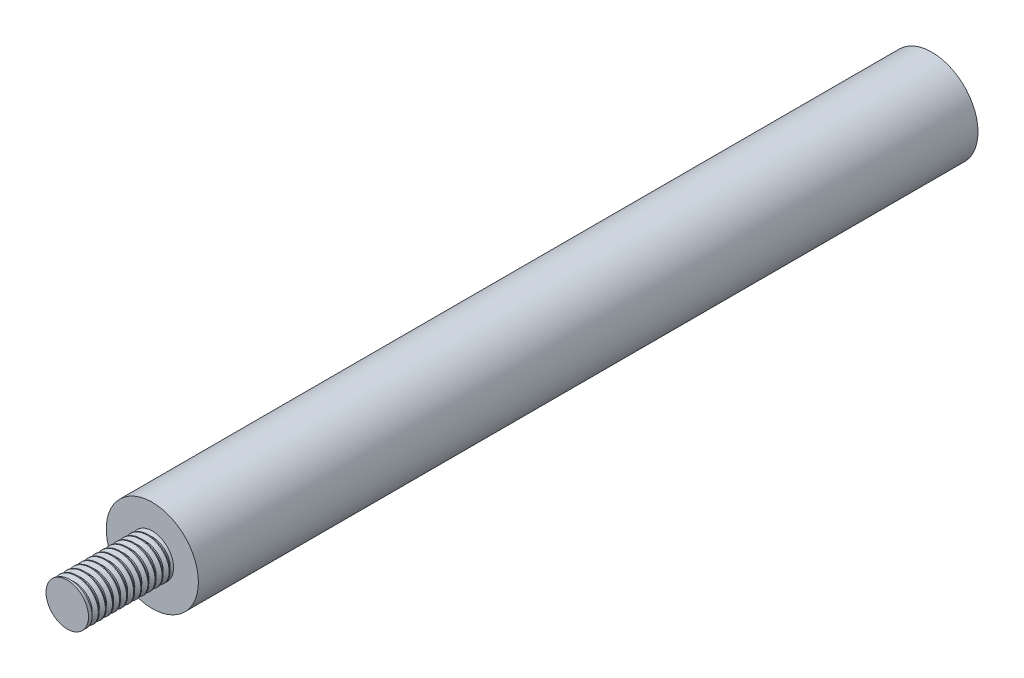
from build123d import *

# Parameters (mm, degrees)
SKETCH1_R           = 3
BOSS_EXTRUDE1_DEPTH = 122
SKETCH1_3_R         = 6.5
SKETCH1_3_R_2       = 3
BOSS_EXTRUDE2_DEPTH = 110
THREAD1_PITCH       = 1
SKETCH4_R           = 3
CUT_EXTRUDE1_DEPTH  = 10


with BuildPart() as part:
    # Sketch1 → Boss-Extrude1 (new body)
    with BuildSketch(Plane.XY):
        with Locations(Location((0, 0, 0), (0, 0, 180))):
            Circle(SKETCH1_R)
    extrude(amount=BOSS_EXTRUDE1_DEPTH)

    # Sketch1<3> → Boss-Extrude2 (add)
    with BuildSketch(Plane.XY):
        Circle(SKETCH1_3_R)
        with Locations(Location((0, 0, 0), (0, 0, 180))):
            Circle(SKETCH1_3_R_2, mode=Mode.SUBTRACT)
    extrude(amount=BOSS_EXTRUDE2_DEPTH)

    # Thread1: the profile of Thread Profile1 profile screwed along a right-hand helix of 12 turns, 8 arcs to a turn; built about Z, then put on its axis
    thread1_z = Axis((0, 0, 0), (0, 0, 1))
    thread1_corners = [(3.0003, 0, -0.000173205), (3.0003, 0, 0.875173202), (2.458734125, 0, 0.562499999), (2.458734125, 0, 0.312499999)]
    with BuildLine(mode=Mode.PRIVATE) as thread1_profile:
        Line(thread1_corners[0], thread1_corners[1])
        Line(thread1_corners[1], thread1_corners[2])
        Line(thread1_corners[2], thread1_corners[3])
        Line(thread1_corners[3], thread1_corners[0])
    thread1_cap = Face(thread1_profile.wire())
    thread1_turn_angles = [0, 22.5, 45, 67.5, 90, 112.5, 135, 157.5, 180, 202.5, 225, 247.5, 270, 292.5, 315, 337.5, 360]
    thread1_turn_weights = [1, 0.9238795325112867, 1, 0.9238795325112867, 1, 0.9238795325112867, 1, 0.9238795325112867, 1, 0.9238795325112867, 1, 0.9238795325112867, 1, 0.9238795325112867, 1, 0.9238795325112867, 1]
    thread1_turn_rails = [Edge.make_bspline([Vector(p[0], p[1], 0).rotate(thread1_z, thread1_turn_angles[k]) / thread1_turn_weights[k] + Vector(0, 0, p[2] + THREAD1_PITCH * thread1_turn_angles[k] / 360) for k in range(17)], [0, 0, 0, 1, 1, 2, 2, 3, 3, 4, 4, 5, 5, 6, 6, 7, 7, 8, 8, 8], 2, thread1_turn_weights) for p in thread1_corners]
    thread1_turn_sides = [Face.make_surface_from_curves(thread1_turn_rails[p[0]], thread1_turn_rails[p[1]]) for p in [(0, 1), (1, 2), (2, 3), (3, 0)]]
    thread1 = Plane(origin=(0, 0, 122), x_dir=(-1, 0, 0), z_dir=(0, 0, -1)) * Solid(Shell([*[p.moved(Location((0, 0, THREAD1_PITCH * i))) for i in range(12) for p in thread1_turn_sides], thread1_cap, thread1_cap.rotate(thread1_z, 4320).moved(Location((0, 0, THREAD1_PITCH * 4320 / 360)))]))
    add(thread1, mode=Mode.SUBTRACT)

    # Sketch4 → Cut-Extrude1 (cut)
    with BuildSketch(Plane(origin=(0, 0, 0), x_dir=(-1, 0, 0), z_dir=(0, 0, -1))):
        Circle(SKETCH4_R)
    extrude(amount=-CUT_EXTRUDE1_DEPTH, mode=Mode.SUBTRACT)


solid = part.part
